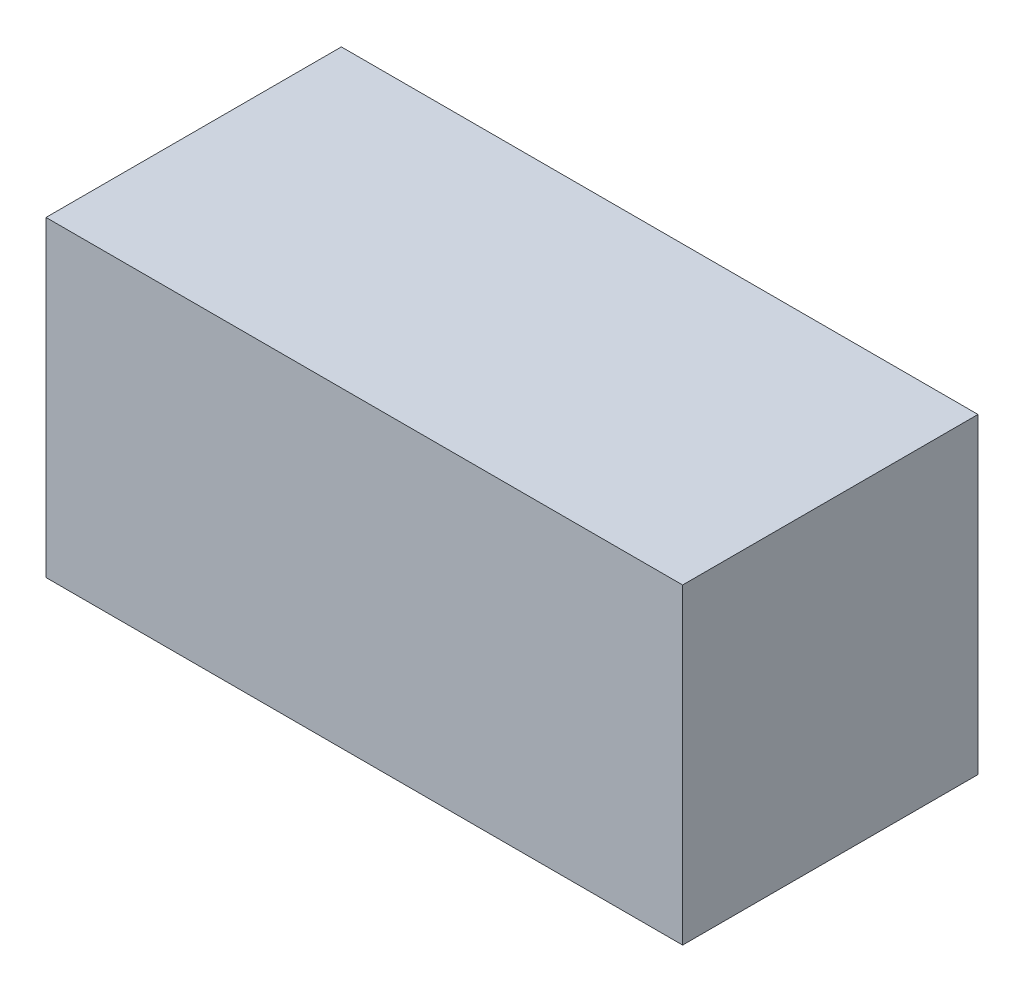
from build123d import *

# Parameters (mm, degrees)
SZKIC1_W                    = 347
SZKIC1_H                    = 161
DODANIE_WYCI_GNI_CIE1_DEPTH = 85


with BuildPart() as part:
    # Szkic1 → Dodanie-wyciągnięcie1 (new, symmetric)
    with BuildSketch(Plane(origin=(0, 0, 0), x_dir=(1, 0, 0), z_dir=(0, 1, 0))):
        Rectangle(SZKIC1_W, SZKIC1_H)
    extrude(amount=DODANIE_WYCI_GNI_CIE1_DEPTH, both=True)


solid = part.part
